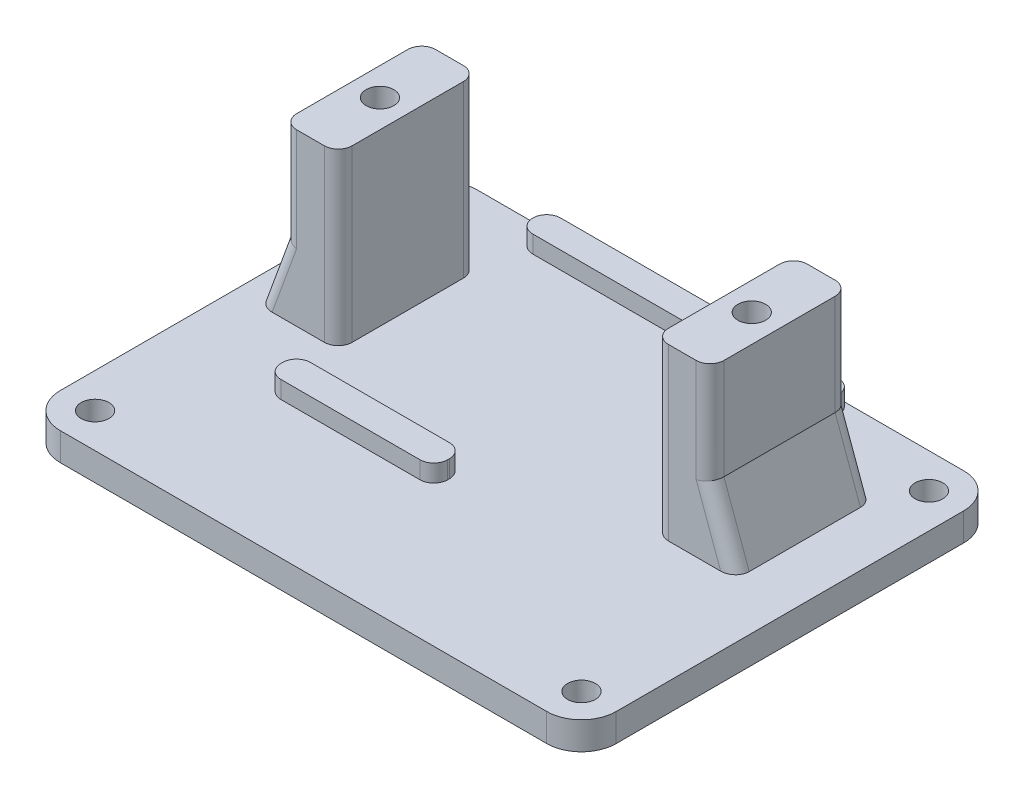
from build123d import *
from OCP.BRepFilletAPI import BRepFilletAPI_MakeChamfer

# Parameters (mm, degrees)
SKETCH_1_W          = 80
SKETCH_1_H          = 60
SKETCH_1_R          = 2
EXTRUDE_1_DEPTH     = 4
FILLET_1_R          = 5
SKETCH_2_W          = 44
SKETCH_2_H          = 4
SKETCH_2_W_2        = 24
SKETCH_2_H_2        = 4.25
EXTRUDE_2_DEPTH     = 2.5
SKETCH_2_3_W        = 8
SKETCH_2_3_H        = 20
EXTRUDE_3_DEPTH     = 24.5
SKETCH_3_R          = 2
CUT_EXTRUDE_1_DEPTH = 7
CHAMFER_1_SIZE      = 10
CHAMFER_1_SIZE2     = 3.639702343
FILLET_2_R          = 2
FILLET_3_R          = 2


with BuildPart() as part:
    # Эскиз1 → Бобышка-Вытянуть1 (new body)
    with BuildSketch(Plane(origin=(0, 0, 0), x_dir=(1, 0, 0), z_dir=(0, 1, 0))):
        Rectangle(SKETCH_1_W, SKETCH_1_H)
        with Locations(Location((-35, 25, 0), (0, 0, 270))):
            Circle(SKETCH_1_R, mode=Mode.SUBTRACT)
        with Locations(Location((35, 25, 0), (0, 0, 270))):
            Circle(SKETCH_1_R, mode=Mode.SUBTRACT)
        with Locations(Location((-35, -25, 0), (0, 0, 270))):
            Circle(SKETCH_1_R, mode=Mode.SUBTRACT)
        with Locations(Location((35, -25, 0), (0, 0, 270))):
            Circle(SKETCH_1_R, mode=Mode.SUBTRACT)
    extrude(amount=EXTRUDE_1_DEPTH)

    # Скругление1
    fillet_1_edges = [part.edges().sort_by_distance(p)[0] for p in [
        (40, 2, 30),
        (-40, 2, 30),
        (-40, 2, -30),
        (40, 2, -30),
    ]]
    fillet(fillet_1_edges, radius=FILLET_1_R)

    # Эскиз2 → Бобышка-Вытянуть2 (add)
    with BuildSketch(Plane(origin=(0, 4, 0), x_dir=(1, 0, 0), z_dir=(0, 1, 0))):
        with Locations((-3, 28)):
            Rectangle(SKETCH_2_W, SKETCH_2_H)
        with Locations((-13, -8.125)):
            Rectangle(SKETCH_2_W_2, SKETCH_2_H_2)
    extrude(amount=EXTRUDE_2_DEPTH)

    # Эскиз2<3> → Бобышка-Вытянуть3 (add)
    with BuildSketch(Plane(origin=(0, 4, 0), x_dir=(1, 0, 0), z_dir=(0, 1, 0))):
        with Locations((24.5, 10)):
            Rectangle(SKETCH_2_3_W, SKETCH_2_3_H)
        with Locations((-29, 10)):
            Rectangle(SKETCH_2_3_W, SKETCH_2_3_H)
    extrude(amount=EXTRUDE_3_DEPTH)

    # Эскиз3 → Вырез-Вытянуть1 (cut)
    with BuildSketch(Plane(origin=(0, 28.5, 0), x_dir=(1, 0, 0), z_dir=(0, 1, 0))):
        with Locations(Location((-29, 10, 0), (0, 0, 270))):
            Circle(SKETCH_3_R)
        with Locations(Location((24.5, 10, 0), (0, 0, 270))):
            Circle(SKETCH_3_R)
    extrude(amount=-CUT_EXTRUDE_1_DEPTH, mode=Mode.SUBTRACT)

    # Фаска1: one chamfer whose edges measure the first distance from different faces: ONE call of the kernel's chamfer builder (chamfer() names one face for all edges)
    chamfer_1_edges_1 = [part.edges().sort_by_distance(p)[0] for p in [
        (28.5, 4, -10),
    ]]
    chamfer_1_side_1 = [part.faces().sort_by_distance(p)[0] for p in [
        (28.5, 16.25, -10),
    ]]
    chamfer_1_edges_2 = [part.edges().sort_by_distance(p)[0] for p in [
        (-33, 4, -10),
    ]]
    chamfer_1_side_2 = [part.faces().sort_by_distance(p)[0] for p in [
        (-33, 16.25, -10),
    ]]
    chamfer_1 = BRepFilletAPI_MakeChamfer(part.part.solid().wrapped)
    for e in chamfer_1_edges_1:
        chamfer_1.Add(CHAMFER_1_SIZE, CHAMFER_1_SIZE2, e.wrapped, chamfer_1_side_1[0].wrapped)  # the first distance lies on this face
    for e in chamfer_1_edges_2:
        chamfer_1.Add(CHAMFER_1_SIZE, CHAMFER_1_SIZE2, e.wrapped, chamfer_1_side_2[0].wrapped)  # the first distance lies on this face
    add(Compound.cast(chamfer_1.Shape()), mode=Mode.REPLACE)

    # Скругление2
    fillet_2_edges = [part.edges().sort_by_distance(p)[0] for p in [
        (-34.819851171, 9, 0),
        (-34.819851171, 9, -20),
        (30.319851171, 9, 0),
        (30.319851171, 9, -20),
        (28.5, 21.25, -20),
        (20.5, 16.25, -20),
        (20.5, 16.25, 0),
        (28.5, 21.25, 0),
        (-25, 16.25, 0),
        (-25, 16.25, -20),
        (-33, 21.25, -20),
        (-33, 21.25, 0),
    ]]
    fillet(fillet_2_edges, radius=FILLET_2_R)

    # Скругление3
    fillet_3_edges = [part.edges().sort_by_distance(p)[0] for p in [
        (-25, 5.25, -26),
        (19, 5.25, -30),
        (-25, 5.25, -30),
        (19, 5.25, -26),
        (-1, 5.25, 6),
        (-25, 5.25, 6),
        (-25, 5.25, 10.25),
        (-1, 5.25, 10.25),
    ]]
    fillet(fillet_3_edges, radius=FILLET_3_R - 0.0001)  # a hair under: the kernel refuses the full size


solid = part.part
